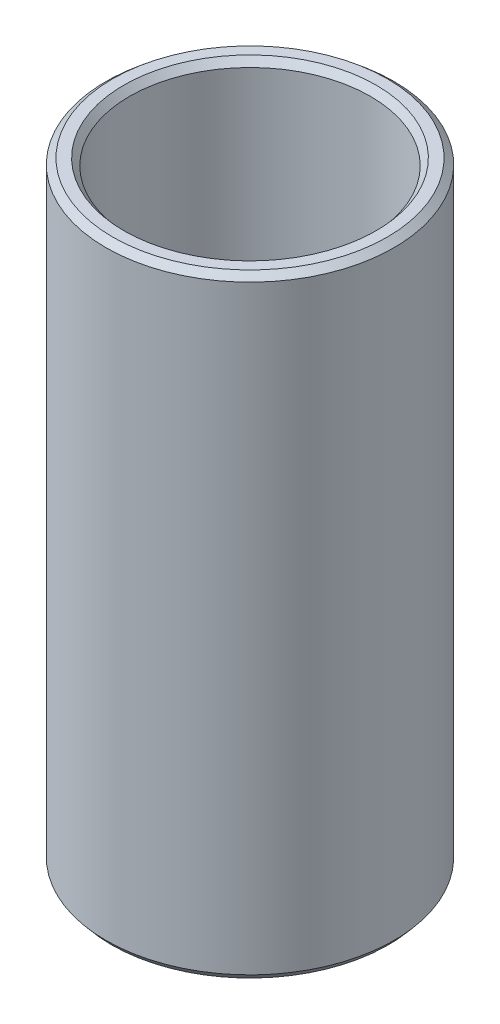
from build123d import *
from OCP.BRepFilletAPI import BRepFilletAPI_MakeChamfer

# Parameters (mm, degrees)
SKETCH1_R           = 47.5
BOSS_EXTRUDE1_DEPTH = 201.987912518
SKETCH2_R           = 39.706598564
CUT_EXTRUDE1_DEPTH  = 213.86525504
CHAMFER1_SIZE       = 1.897915355
CHAMFER1_SIZE2      = 2.246516855


with BuildPart() as part:
    # Sketch1 → Boss-Extrude1 (new body)
    with BuildSketch(Plane(origin=(0, 0, 0), x_dir=(1, 0, 0), z_dir=(0, 1, 0))):
        Circle(SKETCH1_R)
    extrude(amount=BOSS_EXTRUDE1_DEPTH)

    # Sketch2 → Cut-Extrude1 (cut, through all)
    with BuildSketch(Plane(origin=(0, 0, 0), x_dir=(1, 0, 0), z_dir=(0, 1, 0))):
        Circle(SKETCH2_R)
    extrude(amount=CUT_EXTRUDE1_DEPTH, mode=Mode.SUBTRACT)

    # Chamfer1: one chamfer whose edges measure the first distance from different faces: ONE call of the kernel's chamfer builder (chamfer() names one face for all edges)
    chamfer1_edges_1 = [part.edges().sort_by_distance(p)[0] for p in [
        (-39.706598564, 201.987912518, 0),
    ]]
    chamfer1_side_1 = [part.faces().sort_by_distance(p)[0] for p in [
        (-46.156497116, 201.987912518, 0),
    ]]
    chamfer1_edges_2 = [part.edges().sort_by_distance(p)[0] for p in [
        (-39.706598564, 0, 0),
    ]]
    chamfer1_side_2 = [part.faces().sort_by_distance(p)[0] for p in [
        (-39.706598564, 100.993956259, 0),
    ]]
    chamfer1_edges_3 = [part.edges().sort_by_distance(p)[0] for p in [
        (-47.5, 0, 0),
    ]]
    chamfer1_side_3 = [part.faces().sort_by_distance(p)[0] for p in [
        (-46.156497116, 0, 0),
    ]]
    chamfer1_edges_4 = [part.edges().sort_by_distance(p)[0] for p in [
        (-47.5, 201.987912518, 0),
    ]]
    chamfer1_side_4 = [part.faces().sort_by_distance(p)[0] for p in [
        (-47.5, 100.993956259, 0),
    ]]
    chamfer1 = BRepFilletAPI_MakeChamfer(part.part.solid().wrapped)
    for e in chamfer1_edges_1:
        chamfer1.Add(CHAMFER1_SIZE, CHAMFER1_SIZE2, e.wrapped, chamfer1_side_1[0].wrapped)  # the first distance lies on this face
    for e in chamfer1_edges_2:
        chamfer1.Add(CHAMFER1_SIZE, CHAMFER1_SIZE2, e.wrapped, chamfer1_side_2[0].wrapped)  # the first distance lies on this face
    for e in chamfer1_edges_3:
        chamfer1.Add(CHAMFER1_SIZE, CHAMFER1_SIZE2, e.wrapped, chamfer1_side_3[0].wrapped)  # the first distance lies on this face
    for e in chamfer1_edges_4:
        chamfer1.Add(CHAMFER1_SIZE, CHAMFER1_SIZE2, e.wrapped, chamfer1_side_4[0].wrapped)  # the first distance lies on this face
    add(Compound.cast(chamfer1.Shape()), mode=Mode.REPLACE)


solid = part.part
